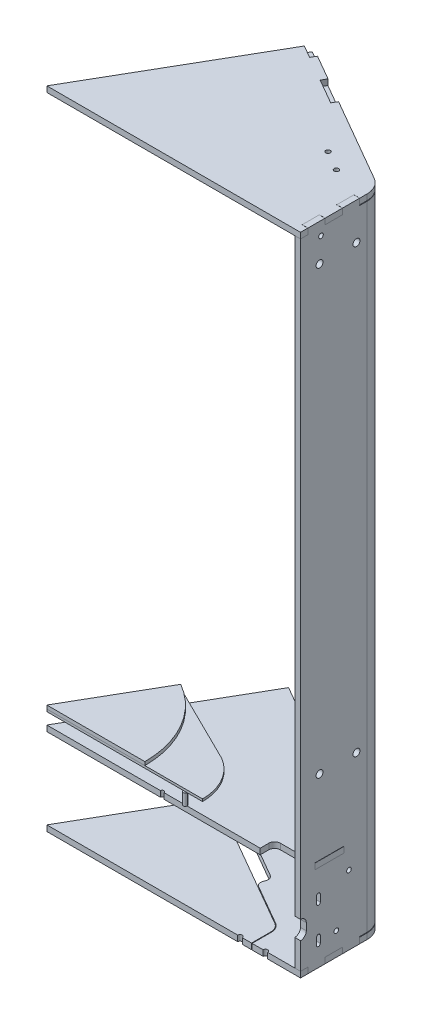
from build123d import *

# Parameters (mm, degrees)
SKETCH2_W             = 5
SKETCH2_H             = 350
BOSS_EXTRUDE1_START   = -95
BOSS_EXTRUDE1_DEPTH   = 5
FILLET1_R             = 17
CUT_EXTRUDE30_DEPTH   = 606.564404964
THICKEN1_START        = -90
THICKEN1_DEPTH        = 550
BOSS_EXTRUDE7_DEPTH   = 5
SKETCH5_W             = 5
SKETCH5_H             = 15
CUT_EXTRUDE1_DEPTH    = 619.092689812
BOSS_EXTRUDE2_REACH   = 620.093
SKETCH7_W             = 5
SKETCH7_H             = 14.8
SKETCH22_W            = 35.037696658
SKETCH22_H            = 0.5
CUT_EXTRUDE8_DEPTH    = 534.538726991
BOSS_EXTRUDE3_DEPTH   = 3
BOSS_EXTRUDE4_DEPTH   = 2
SKETCH10_R            = 130
SKETCH10_R_2          = 85
CUT_EXTRUDE2_DEPTH    = 534.538726991
SKETCH11_R            = 1.625
BOSS_EXTRUDE5_DEPTH   = 10
BOSS_EXTRUDE6_DEPTH   = 5
CUT_EXTRUDE21_DEPTH   = 547.661296599
SKETCH13_W            = 25
SKETCH13_H            = 5.2
CUT_EXTRUDE4_DEPTH    = 534.538726991
CUT_EXTRUDE5_DEPTH    = 10
SKETCH21_R            = 2
CUT_EXTRUDE7_DEPTH    = 532.496541098
SKETCH24_W            = 121.884572681
SKETCH24_H            = 40
BOSS_EXTRUDE8_DEPTH   = 5
BOSS_EXTRUDE8_2_DEPTH = 5
SKETCH27_R            = 2
SKETCH27_R_2          = 3
CUT_EXTRUDE10_DEPTH   = 5
SKETCH25_R            = 2
CUT_EXTRUDE9_DEPTH    = 615.579733281
SKETCH41_R            = 2
CUT_EXTRUDE22_DEPTH   = 620.098738942
CUT_EXTRUDE23_DEPTH   = 620.098738942
CUT_EXTRUDE6_DEPTH    = 10
FILLET2_R             = 5
SKETCH43_R            = 2
CUT_EXTRUDE24_DEPTH   = 620.098738942
SKETCH28_R            = 2
CUT_EXTRUDE11_DEPTH   = 620.098738942
SKETCH29_R            = 2
CUT_EXTRUDE12_DEPTH   = 506.811549291
SKETCH44_R            = 2
CUT_EXTRUDE25_DEPTH   = 506.811549291
LPATTERN1_COUNT       = 10
LPATTERN1_PITCH       = 25
SKETCH47_R            = 2
CUT_EXTRUDE28_DEPTH   = 507.378280988
SKETCH45_W            = 2.5
SKETCH45_H            = 8
CUT_EXTRUDE26_DEPTH   = 10
CUT_EXTRUDE31_DEPTH   = 506.811549291
SKETCH31_R            = 2
SKETCH31_R_2          = 1.5
CUT_EXTRUDE14_DEPTH   = 548.798547424
SKETCH30_W            = 121.884572681
SKETCH30_H            = 474.5
SKETCH30_R            = 2
BOSS_EXTRUDE9_DEPTH   = 5
SKETCH52_R            = 2
CUT_EXTRUDE32_DEPTH   = 506.811549291
SKETCH48_W            = 121.634572681
SKETCH48_H            = 433.75
BOSS_EXTRUDE13_DEPTH  = 5
SKETCH49_R            = 2
CUT_EXTRUDE29_DEPTH   = 507.378280988
SKETCH32_W            = 40
SKETCH32_H            = 28
BOSS_EXTRUDE10_DEPTH  = 28
CUT_EXTRUDE15_DEPTH   = 522.844237142
SKETCH34_W            = 14.5
SKETCH34_H            = 24
CUT_EXTRUDE16_DEPTH   = 24
SKETCH35_R            = 2
CUT_EXTRUDE17_DEPTH   = 506.811549291
BOSS_EXTRUDE11_DEPTH  = 3
CHAMFER1_SIZE         = 2.75
BOSS_EXTRUDE12_DEPTH  = 0.5
CUT_EXTRUDE18_DEPTH   = 1
CHAMFER2_SIZE         = 0.125
CUT_EXTRUDE20_DEPTH   = 522.844237142
CHAMFER3_SIZE         = 0.25


# Read off the part's stored shape, not the designer's step: Thicken1
with BuildPart() as part:
    # Sketch2 → Revolve1 (revolve)
    with BuildSketch(Plane(origin=(195, 0, 0), x_dir=(0, 0, -1), z_dir=(1, 0, 0))):
        with Locations((30, 275)):
            Rectangle(SKETCH2_W, SKETCH2_H)
    revolve(axis=Axis((195, 450, -32.5), (0, -1, 0)))


with BuildPart() as body_2:
    # Sketch3 → Boss-Extrude1 (new body)
    with BuildSketch(Plane(origin=(0, 0, 0), x_dir=(1, 0, 0), z_dir=(0, 1, 0)).offset(BOSS_EXTRUDE1_START)):
        Polygon((220, 67.5), (84.228357378, 145.887794416), (0, 0), (220, 0), (220, 32.5), align=None)
    extrude(amount=BOSS_EXTRUDE1_DEPTH)

    # Fillet1
    fillet1_edges = [body_2.edges().sort_by_distance(p)[0] for p in [
        (220, -92.5, -67.5),
    ]]
    fillet(fillet1_edges, radius=FILLET1_R)

    # Sketch50 → Cut-Extrude30 (cut, through all)
    with BuildSketch(Plane.XZ.offset(95)):
        Polygon((81.728357378, -141.557667397), (92.553674925, -135.307667397), (95.053674925, -139.637794416), (84.228357378, -145.887794416), align=None)
        Polygon((116.70431002, -127.137794416), (114.20431002, -122.807667397), (135.854945114, -110.307667397), (138.354945114, -114.637794416), align=None)
    extrude(amount=-CUT_EXTRUDE30_DEPTH, mode=Mode.SUBTRACT)


with BuildPart() as body_3:
    # Thicken1 outline → Thicken1 (new body)
    with BuildSketch(Plane(origin=(0, 0, 0), x_dir=(1, 0, 0), z_dir=(0, 1, 0)).offset(THICKEN1_START)):
        with BuildLine():
            Line((211.5, 72.407477288), (190, 84.820508076))
            Line((190, 84.820508076), (187.5, 80.490381057))
            Line((187.5, 80.490381057), (209, 68.077350269))
            ThreePointArc((209, 68.077350269), (213.392304845, 63.685045424), (215, 57.685045424))
            Line((215, 57.685045424), (215, 0))
            Line((215, 0), (220, 0))
            Line((220, 0), (220, 57.685045424))
            ThreePointArc((220, 57.685045424), (217.722431864, 66.185045424), (211.5, 72.407477288))
        make_face()
    extrude(amount=THICKEN1_DEPTH)



with BuildPart() as body_4:
    # Sketch23 → Boss-Extrude7 (new body)
    with BuildSketch(Plane(origin=(0, 460, 0), x_dir=(1, 0, 0), z_dir=(0, 1, 0))):
        with BuildLine():
            Line((220, 0), (220, 57.685045424))
            ThreePointArc((220, 57.685045424), (217.722431864, 66.185045424), (211.5, 72.407477288))
            Line((211.5, 72.407477288), (138.354945114, 114.637794416))
            Line((138.354945114, 114.637794416), (135.854945114, 110.307667397))
            Line((135.854945114, 110.307667397), (114.20431002, 122.807667397))
            Line((114.20431002, 122.807667397), (116.70431002, 127.137794416))
            Line((116.70431002, 127.137794416), (95.053674925, 139.637794416))
            Line((95.053674925, 139.637794416), (92.553674925, 135.307667397))
            Line((92.553674925, 135.307667397), (81.728357378, 141.557667397))
            Line((81.728357378, 141.557667397), (0, 0))
            Line((0, 0), (220, 0))
        make_face()
    extrude(amount=BOSS_EXTRUDE7_DEPTH)


with BuildPart() as cut_extrude1_tool:
    # Sketch5 → Cut-Extrude1 (new, through all)
    with BuildSketch(Plane.XZ.offset(95)):
        with Locations((217.5, -43.842522712)):
            Rectangle(SKETCH5_W, SKETCH5_H)
        with Locations((217.5, -13.842522712)):
            Rectangle(SKETCH5_W, SKETCH5_H)
    extrude(amount=-CUT_EXTRUDE1_DEPTH)


with BuildPart() as body_2_1:
    add(body_2.part)

    # Cut-Extrude1: cut by cut_extrude1_tool
    add(cut_extrude1_tool.part, mode=Mode.SUBTRACT)

    # Sketch25 → Cut-Extrude9 (cut, through all)
    with BuildSketch(Plane(origin=(0, -90, 0), x_dir=(1, 0, 0), z_dir=(0, 1, 0))):
        with Locations(Location((200, 31, 0), (0, 0, 270))):
            Circle(SKETCH25_R)
        with Locations((189.5, 0)):
            Circle(SKETCH25_R)
        with Locations(Location((188.660254038, 62.5, 0), (0, 0, 270))):
            Circle(SKETCH25_R)
        with Locations(Location((171.339745962, 72.5, 0), (0, 0, 270))):
            Circle(SKETCH25_R)
    extrude(amount=-CUT_EXTRUDE9_DEPTH, mode=Mode.SUBTRACT)

    # Sketch41 → Cut-Extrude22 (cut, through all)
    with BuildSketch(Plane.XZ.offset(95)):
        with Locations((167.5, 0)):
            Circle(SKETCH41_R)
    extrude(amount=-CUT_EXTRUDE22_DEPTH, mode=Mode.SUBTRACT)

    # Sketch42 → Cut-Extrude23 (cut, through all)
    with BuildSketch(Plane.XZ.offset(95)):
        with BuildLine():
            Line((108.354945114, -62.676270189), (54.228357378, -93.926270189))
            Line((54.228357378, -93.926270189), (53.978357378, -93.493257487))
            Line((53.978357378, -93.493257487), (108.104945114, -62.243257487))
            Line((108.104945114, -62.243257487), (172.75, -24.920417647))
            ThreePointArc((172.75, -24.920417647), (176.227241336, -21.443176311), (177.5, -16.693176311))
            Line((177.5, -16.693176311), (177.5, 0))
            Line((177.5, 0), (178, 0))
            Line((178, 0), (178, -16.693176311))
            ThreePointArc((178, -16.693176311), (176.660254038, -21.693176311), (173, -25.353430349))
            Line((173, -25.353430349), (108.354945114, -62.676270189))
        make_face()
    extrude(amount=-CUT_EXTRUDE23_DEPTH, mode=Mode.SUBTRACT)


with BuildPart() as body_4_1:
    add(body_4.part)

    # Cut-Extrude1: cut by cut_extrude1_tool
    add(cut_extrude1_tool.part, mode=Mode.SUBTRACT)


with BuildPart() as body_3_1:
    add(body_3.part)

    # Boss-Extrude2: up to this face of the body (flat: up to its plane)
    boss_extrude2_end = Plane(body_4_1.part.faces().sort_by_distance((116.920273172, 465, -53.131070851))[0])
    # Sketch7 → Boss-Extrude2 (add, up to the picked face)
    with BuildSketch(Plane.XZ.offset(95), mode=Mode.PRIVATE) as boss_extrude2_sk1:
        with Locations((217.5, -13.842522712)):
            Rectangle(SKETCH7_W, SKETCH7_H)
    boss_extrude2_tool1 = split(extrude(boss_extrude2_sk1.sketch, amount=-BOSS_EXTRUDE2_REACH, mode=Mode.PRIVATE), bisect_by=boss_extrude2_end, keep=Keep.BOTH, mode=Mode.PRIVATE)
    # Sketch7 → Boss-Extrude2 (add, up to the picked face)
    with BuildSketch(Plane.XZ.offset(95), mode=Mode.PRIVATE) as boss_extrude2_sk2:
        with Locations((217.5, -43.842522712)):
            Rectangle(SKETCH7_W, SKETCH7_H)
    boss_extrude2_tool2 = split(extrude(boss_extrude2_sk2.sketch, amount=-BOSS_EXTRUDE2_REACH, mode=Mode.PRIVATE), bisect_by=boss_extrude2_end, keep=Keep.BOTH, mode=Mode.PRIVATE)
    add(boss_extrude2_tool1.solids().sort_by(Axis((217.5, -95, -13.842523), (0, 1, 0)))[0])
    add(boss_extrude2_tool2.solids().sort_by(Axis((217.5, -95, -43.842523), (0, 1, 0)))[0])

    # Sketch22 → Cut-Extrude8 (cut, through all)
    with BuildSketch(Plane(origin=(220, 0, 0), x_dir=(0, 0, -1), z_dir=(1, 0, 0))):
        with Locations((68.761371041, -89.75)):
            Rectangle(SKETCH22_W, SKETCH22_H)
        with Locations((68.761371041, 459.75)):
            Rectangle(SKETCH22_W, SKETCH22_H)
    extrude(amount=-CUT_EXTRUDE8_DEPTH, mode=Mode.SUBTRACT)

    # Sketch13 → Cut-Extrude4 (cut, through all)
    with BuildSketch(Plane(origin=(220, 0, 0), x_dir=(0, 0, -1), z_dir=(1, 0, 0))):
        with Locations((25, -17.4)):
            Rectangle(SKETCH13_W, SKETCH13_H)
    extrude(amount=-CUT_EXTRUDE4_DEPTH, mode=Mode.SUBTRACT)

    # Sketch14 → Cut-Extrude5 (cut)
    with BuildSketch(Plane(origin=(220, 0, 0), x_dir=(0, 0, -1), z_dir=(1, 0, 0))):
        with BuildLine():
            Line((13.875, -40.5), (13.875, -46.5))
            ThreePointArc((13.875, -46.5), (15.5, -48.125), (17.125, -46.5))
            Line((17.125, -46.5), (17.125, -40.5))
            ThreePointArc((17.125, -40.5), (15.5, -38.875), (13.875, -40.5))
        make_face()
        with BuildLine():
            Line((17.125, -71.5), (17.125, -77.5))
            ThreePointArc((17.125, -77.5), (15.5, -79.125), (13.875, -77.5))
            Line((13.875, -77.5), (13.875, -71.5))
            ThreePointArc((13.875, -71.5), (15.5, -69.875), (17.125, -71.5))
        make_face()
        with BuildLine():
            Line((5, -56), (5, -62))
            ThreePointArc((5, -62), (0, -67), (-5, -62))
            Line((-5, -62), (-5, -56))
            ThreePointArc((-5, -56), (0, -51), (5, -56))
        make_face()
    extrude(amount=-CUT_EXTRUDE5_DEPTH, mode=Mode.SUBTRACT)

    # Sketch21 → Cut-Extrude7 (cut, through all)
    with BuildSketch(Plane.ZY.offset(-215)):
        with Locations((-31, -75)):
            Circle(SKETCH21_R)
    extrude(amount=-CUT_EXTRUDE7_DEPTH, mode=Mode.SUBTRACT)

    # Sketch27 → Cut-Extrude10 (cut)
    with BuildSketch(Plane.ZY.offset(-215)):
        with Locations((-17.75, 453.5)):
            Circle(SKETCH27_R)
        with Locations((-42, -35)):
            Circle(SKETCH27_R)
        with Locations((-48.5, 433)):
            Circle(SKETCH27_R_2)
        with Locations((-16.5, 433)):
            Circle(SKETCH27_R_2)
        with Locations((-16.5, 50)):
            Circle(SKETCH27_R_2)
        with Locations((-48.5, 50)):
            Circle(SKETCH27_R_2)
    extrude(amount=-CUT_EXTRUDE10_DEPTH, mode=Mode.SUBTRACT)


with BuildPart() as body_5:
    # Sketch8 → Boss-Extrude3 (new body)
    with BuildSketch(Plane(origin=(0, 0, 0), x_dir=(1, 0, 0), z_dir=(0, 1, 0))):
        with BuildLine():
            Line((110, 34.641016151), (42.5, 73.612159322))
            Line((42.5, 73.612159322), (0, 0))
            Line((0, 0), (130, 0))
            ThreePointArc((130, 0), (124.641016151, 20), (110, 34.641016151))
        make_face()
    extrude(amount=-BOSS_EXTRUDE3_DEPTH)

    # Sketch10 → Cut-Extrude2 (cut, through all)
    with BuildSketch(Plane(origin=(0, 0, 0), x_dir=(1, 0, 0), z_dir=(0, 1, 0))):
        Circle(SKETCH10_R)
        Circle(SKETCH10_R_2, mode=Mode.SUBTRACT)
    extrude(amount=-CUT_EXTRUDE2_DEPTH, mode=Mode.SUBTRACT)


with BuildPart() as body_6:
    # Sketch9 → Boss-Extrude4 (new body)
    with BuildSketch(Plane.XZ.offset(3)):
        with BuildLine():
            Line((135, 0), (0, 0))
            Line((0, 0), (42.5, -73.612159322))
            Line((42.5, -73.612159322), (112.5, -38.97114317))
            ThreePointArc((112.5, -38.97114317), (128.97114317, -22.5), (135, 0))
        make_face()
    extrude(amount=BOSS_EXTRUDE4_DEPTH)


with BuildPart() as body_7:
    # Sketch11 → Boss-Extrude5 (new body)
    with BuildSketch(Plane.XZ.offset(5)):
        with Locations(Location((120, 0, 0), (0, 0, 270))):
            Circle(SKETCH11_R)
    extrude(amount=BOSS_EXTRUDE5_DEPTH)


with BuildPart() as body_8:
    # Sketch12 → Boss-Extrude6 (new body)
    with BuildSketch(Plane.XZ.offset(15)):
        Polygon((215, -53.06624327), (76.728357378, -132.89741336), (0, 0), (215, 0), (215, -12.5), (220, -12.5), (220, -37.5), (215, -37.5), align=None)
    extrude(amount=BOSS_EXTRUDE6_DEPTH)

    # Sketch40 → Cut-Extrude21 (cut, through all)
    with BuildSketch(Plane(origin=(0, -15, 0), x_dir=(1, 0, 0), z_dir=(0, 1, 0))):
        with BuildLine():
            Line((215, 12.5), (190, 12.5))
            ThreePointArc((190, 12.5), (186.464466094, 11.035533906), (185, 7.5))
            Line((185, 7.5), (185, 0))
            Line((185, 0), (215, 0))
            Line((215, 0), (215, 12.5))
        make_face()
    extrude(amount=-CUT_EXTRUDE21_DEPTH, mode=Mode.SUBTRACT)

    # Sketch31 → Cut-Extrude14 (cut, through all)
    with BuildSketch(Plane(origin=(0, -15, 0), x_dir=(1, 0, 0), z_dir=(0, 1, 0))):
        with Locations(Location((200, 42, 0), (0, 0, 270))):
            Circle(SKETCH31_R)
        with Locations(Location((149.689110868, 85, 0), (0, 0, 270))):
            Circle(SKETCH31_R)
        with Locations(Location((188.660254038, 62.5, 0), (0, 0, 270))):
            Circle(SKETCH31_R)
        with Locations(Location((171.339745962, 72.5, 0), (0, 0, 270))):
            Circle(SKETCH31_R)
        with Locations((100, 0)):
            Circle(SKETCH31_R_2)
    extrude(amount=-CUT_EXTRUDE14_DEPTH, mode=Mode.SUBTRACT)


with BuildPart() as body_9:
    # Sketch24 → Boss-Extrude8 (new body)
    with BuildSketch(Plane(origin=(84.228357378, 0, -145.887794416), x_dir=(-0.8660254037844382, 0, -0.5000000000000007), z_dir=(0.5000000000000008, 0, -0.8660254037844383))):
        with Locations((-60.942286341, 439.75)):
            Rectangle(SKETCH24_W, SKETCH24_H)
    extrude(amount=-BOSS_EXTRUDE8_DEPTH)


with BuildPart() as body_10:
    # Sketch24 → Boss-Extrude8 2 (new body)
    with BuildSketch(Plane(origin=(84.228357378, 0, -145.887794416), x_dir=(-0.8660254037844382, 0, -0.5000000000000007), z_dir=(0.5000000000000008, 0, -0.8660254037844383))):
        Polygon((-121.884572681, -89.75), (-62.4, -89.75), (-62.4, -95), (-37.6, -95), (-37.6, -89.75), (-12.4, -89.75), (-12.4, -95), (0, -95), (0, -89.75), (0, -15), (-121.884572681, -15), align=None)
    extrude(amount=-BOSS_EXTRUDE8_2_DEPTH)


with BuildPart() as cut_extrude23_piece_1:
    # of the separate pieces the step leaves, piece 1, a body of its own (cut_extrude23_pieces)
    add(body_2_1.part.solids().sort_by_distance((211.5, -95, -72.407477288))[0])

    # Sketch20 → Cut-Extrude6 (cut)
    with BuildSketch(Plane(origin=(0, -90, 0), x_dir=(1, 0, 0), z_dir=(0, 1, 0))):
        Polygon((67.888611416, 97.586524227), (139.019237886, 56.519237886), (134.019237886, 47.858983849), (62.888611416, 88.926270189), align=None)
    extrude(amount=-CUT_EXTRUDE6_DEPTH, mode=Mode.SUBTRACT)

    # Fillet2
    fillet2_edges = [cut_extrude23_piece_1.edges().sort_by_distance(p)[0] for p in [
        (67.888611416, -92.5, -97.586524227),
        (139.019237886, -92.5, -56.519237886),
    ]]
    fillet(fillet2_edges, radius=FILLET2_R)
    fillet2_2_edges = [cut_extrude23_piece_1.edges().sort_by_distance(p)[0] for p in [
        (62.888611416, -92.5, -88.926270189),
        (134.019237886, -92.5, -47.858983849),
    ]]
    fillet(fillet2_2_edges, radius=FILLET2_R - 0.0001)  # a hair under: the kernel refuses the full size


with BuildPart() as cut_extrude23_piece_2:
    # of the separate pieces the step leaves, piece 2, a body of its own (cut_extrude23_pieces)
    add(body_2_1.part.solids().sort_by_distance((53.978357378, -95, -93.493257487))[0])


with BuildPart() as cut_extrude24_tool:
    # Sketch43 → Cut-Extrude24 (new, through all)
    with BuildSketch(Plane.XZ.offset(95)):
        with Locations((59.103357378, -102.370017876)):
            Circle(SKETCH43_R)
        with Locations((49.103357378, -85.0495098)):
            Circle(SKETCH43_R)
    extrude(amount=-CUT_EXTRUDE24_DEPTH)


with BuildPart() as cut_extrude23_piece_1_1:
    add(cut_extrude23_piece_1.part)

    # Cut-Extrude24: cut by cut_extrude24_tool
    add(cut_extrude24_tool.part, mode=Mode.SUBTRACT)


with BuildPart() as cut_extrude23_piece_2_1:
    add(cut_extrude23_piece_2.part)

    # Cut-Extrude24: cut by cut_extrude24_tool
    add(cut_extrude24_tool.part, mode=Mode.SUBTRACT)


with BuildPart() as body_4_2:
    add(body_4_1.part)

    # Sketch28 → Cut-Extrude11 (cut, through all)
    with BuildSketch(Plane(origin=(0, 465, 0), x_dir=(1, 0, 0), z_dir=(0, 1, 0))):
        with Locations(Location((171.339745962, 72.5, 0), (0, 0, 270))):
            Circle(SKETCH28_R)
        with Locations(Location((188.660254038, 62.5, 0), (0, 0, 270))):
            Circle(SKETCH28_R)
    extrude(amount=-CUT_EXTRUDE11_DEPTH, mode=Mode.SUBTRACT)


with BuildPart() as cut_extrude12_tool:
    # Sketch29 → Cut-Extrude12 (new, through all)
    with BuildSketch(Plane(origin=(81.728357378, 0, -141.557667397), x_dir=(0.8660254037844384, 0, 0.5000000000000007), z_dir=(-0.5000000000000007, 0, 0.8660254037844384))):
        with Locations((112.134572681, -75)):
            Circle(SKETCH29_R)
        with Locations((87.134572681, -35)):
            Circle(SKETCH29_R)
        with Locations((112.134572681, 445)):
            Circle(SKETCH29_R)
        with BuildLine():
            Line((129.134572681, 447), (135.134572681, 447))
            ThreePointArc((135.134572681, 447), (137.134572681, 445), (135.134572681, 443))
            Line((135.134572681, 443), (129.134572681, 443))
            ThreePointArc((129.134572681, 443), (127.134572681, 445), (129.134572681, 447))
        make_face()
        with BuildLine():
            Line((129.134572681, -73), (135.134572681, -73))
            ThreePointArc((135.134572681, -73), (137.134572681, -75), (135.134572681, -77))
            Line((135.134572681, -77), (129.134572681, -77))
            ThreePointArc((129.134572681, -77), (127.134572681, -75), (129.134572681, -73))
        make_face()
    extrude(amount=-CUT_EXTRUDE12_DEPTH)


with BuildPart() as body_3_2:
    add(body_3_1.part)

    # Cut-Extrude12: cut by cut_extrude12_tool
    add(cut_extrude12_tool.part, mode=Mode.SUBTRACT)

    # Sketch44 → Cut-Extrude25 (cut, through all)
    with BuildSketch(Plane(origin=(81.728357378, 0, -141.557667397), x_dir=(0.8660254037844382, 0, 0.5000000000000007), z_dir=(-0.5000000000000008, 0, 0.8660254037844383))):
        with Locations((134.384572681, 189.875)):
            Circle(SKETCH44_R)
    cut_extrude25 = extrude(amount=-CUT_EXTRUDE25_DEPTH, mode=Mode.SUBTRACT)

    # LPattern1: Cut-Extrude25 ×10, 3 skipped
    with Locations(*[(0, -i * LPATTERN1_PITCH, 0) for i in range(1, LPATTERN1_COUNT) if i not in (3, 8, 9)]):
        add(cut_extrude25, mode=Mode.SUBTRACT)

    # Sketch47 → Cut-Extrude28 (cut, through all)
    with BuildSketch(Plane(origin=(84.228357378, 0, -145.887794416), x_dir=(-0.8660254037844382, 0, -0.5000000000000007), z_dir=(0.5000000000000008, 0, -0.8660254037844383))):
        with Locations(Location((-134.384572681, 189.875, 0), (0, 0, 180))):
            Circle(SKETCH47_R)
        with Locations(Location((-134.384572681, 164.875, 0), (0, 0, 180))):
            Circle(SKETCH47_R)
        with Locations(Location((-134.384572681, 139.875, 0), (0, 0, 180))):
            Circle(SKETCH47_R)
        with Locations(Location((-134.384572681, 89.875, 0), (0, 0, 180))):
            Circle(SKETCH47_R)
        with Locations(Location((-134.384572681, 64.875, 0), (0, 0, 180))):
            Circle(SKETCH47_R)
        with Locations(Location((-134.384572681, 39.875, 0), (0, 0, 180))):
            Circle(SKETCH47_R)
        with Locations(Location((-134.384572681, 14.875, 0), (0, 0, 180))):
            Circle(SKETCH47_R)
        with Locations(Location((-134.384572681, 389.875, 0), (0, 0, 180))):
            Circle(SKETCH47_R)
        with Locations(Location((-134.384572681, 364.875, 0), (0, 0, 180))):
            Circle(SKETCH47_R)
        with Locations(Location((-134.384572681, 339.875, 0), (0, 0, 180))):
            Circle(SKETCH47_R)
        with Locations(Location((-134.384572681, 314.875, 0), (0, 0, 180))):
            Circle(SKETCH47_R)
        with Locations(Location((-134.384572681, 264.875, 0), (0, 0, 180))):
            Circle(SKETCH47_R)
        with Locations(Location((-134.384572681, 239.875, 0), (0, 0, 180))):
            Circle(SKETCH47_R)
        with Locations(Location((-134.384572681, 214.875, 0), (0, 0, 180))):
            Circle(SKETCH47_R)
    extrude(amount=-CUT_EXTRUDE28_DEPTH, mode=Mode.SUBTRACT)

    # Sketch45 → Cut-Extrude26 (cut)
    with BuildSketch(Plane(origin=(84.228357378, 0, -145.887794416), x_dir=(-0.8660254037844382, 0, -0.5000000000000007), z_dir=(0.5000000000000008, 0, -0.8660254037844383))):
        with Locations((-130.634572681, 114.875)):
            Rectangle(SKETCH45_W, SKETCH45_H)
        with Locations((-130.634572681, 414.875)):
            Rectangle(SKETCH45_W, SKETCH45_H)
        with Locations((-138.134572681, 414.875)):
            Rectangle(SKETCH45_W, SKETCH45_H)
        with Locations((-130.634572681, 289.875)):
            Rectangle(SKETCH45_W, SKETCH45_H)
        with Locations((-138.134572681, 289.875)):
            Rectangle(SKETCH45_W, SKETCH45_H)
        with Locations((-138.134572681, 114.875)):
            Rectangle(SKETCH45_W, SKETCH45_H)
        with Locations((-130.634572681, -35.125)):
            Rectangle(SKETCH45_W, SKETCH45_H)
        with Locations((-138.134572681, -35.125)):
            Rectangle(SKETCH45_W, SKETCH45_H)
    extrude(amount=-CUT_EXTRUDE26_DEPTH, mode=Mode.SUBTRACT)

    # Sketch51 → Cut-Extrude31 (cut, through all)
    with BuildSketch(Plane(origin=(81.728357378, 0, -141.557667397), x_dir=(0.8660254037844382, 0, 0.5000000000000007), z_dir=(-0.5000000000000008, 0, 0.8660254037844383))):
        with BuildLine():
            Line((129.134572681, 2), (135.134572681, 2))
            ThreePointArc((135.134572681, 2), (137.134572681, 0), (135.134572681, -2))
            Line((135.134572681, -2), (129.134572681, -2))
            ThreePointArc((129.134572681, -2), (127.134572681, 0), (129.134572681, 2))
        make_face()
    extrude(amount=-CUT_EXTRUDE31_DEPTH, mode=Mode.SUBTRACT)


with BuildPart() as body_9_1:
    add(body_9.part)

    # Cut-Extrude12: cut by cut_extrude12_tool
    add(cut_extrude12_tool.part, mode=Mode.SUBTRACT)


with BuildPart() as body_10_1:
    add(body_10.part)

    # Cut-Extrude12: cut by cut_extrude12_tool
    add(cut_extrude12_tool.part, mode=Mode.SUBTRACT)


with BuildPart() as body_12:
    # Sketch30 → Boss-Extrude9 (new body)
    with BuildSketch(Plane(origin=(84.228357378, 0, -145.887794416), x_dir=(-0.8660254037844384, 0, -0.5000000000000007), z_dir=(0.5000000000000007, 0, -0.8660254037844384))):
        with Locations((-60.942286341, 222.5)):
            Rectangle(SKETCH30_W, SKETCH30_H)
        with Locations((-112.134572681, 445)):
            Circle(SKETCH30_R, mode=Mode.SUBTRACT)
        with Locations((-112.134572681, 0)):
            Circle(SKETCH30_R, mode=Mode.SUBTRACT)
    extrude(amount=-BOSS_EXTRUDE9_DEPTH)

    # Sketch52 → Cut-Extrude32 (cut, through all)
    with BuildSketch(Plane(origin=(81.728357378, 0, -141.557667397), x_dir=(0.8660254037844384, 0, 0.5000000000000007), z_dir=(-0.5000000000000007, 0, 0.8660254037844384))):
        with Locations((109.384572681, 214.875)):
            Circle(SKETCH52_R)
        with Locations((109.384572681, 189.875)):
            Circle(SKETCH52_R)
    extrude(amount=-CUT_EXTRUDE32_DEPTH, mode=Mode.SUBTRACT)


with BuildPart() as body_13:
    # Sketch48 → Boss-Extrude13 (new body)
    with BuildSketch(Plane(origin=(84.228357378, 0, -145.887794416), x_dir=(-0.8660254037844382, 0, -0.5000000000000009), z_dir=(0.5000000000000009, 0, -0.8660254037844382))):
        with Locations((-60.817286341, 202.375)):
            Rectangle(SKETCH48_W, SKETCH48_H)
    extrude(amount=-BOSS_EXTRUDE13_DEPTH)

    # Sketch49 → Cut-Extrude29 (cut, through all)
    with BuildSketch(Plane(origin=(84.228357378, 0, -145.887794416), x_dir=(-0.866025403784438, 0, -0.5000000000000012), z_dir=(0.5000000000000011, 0, -0.8660254037844379))):
        with Locations((-109.384572681, 389.875)):
            Circle(SKETCH49_R)
        with Locations((-109.384572681, 364.875)):
            Circle(SKETCH49_R)
        with Locations((-109.384572681, 39.875)):
            Circle(SKETCH49_R)
        with Locations((-109.384572681, 14.875)):
            Circle(SKETCH49_R)
    extrude(amount=-CUT_EXTRUDE29_DEPTH, mode=Mode.SUBTRACT)


with BuildPart() as body_14:
    # Sketch32 → Boss-Extrude10 (new body)
    with BuildSketch(Plane(origin=(81.728357378, 0, -141.557667397), x_dir=(0.8660254037844382, 0, 0.5000000000000007), z_dir=(-0.5000000000000008, 0, 0.8660254037844383))):
        with Locations((122.134572681, -76)):
            Rectangle(SKETCH32_W, SKETCH32_H)
    extrude(amount=BOSS_EXTRUDE10_DEPTH)

    # Sketch33 → Cut-Extrude15 (cut, through all)
    with BuildSketch(Plane(origin=(88.451134547, 0, 51.067286341), x_dir=(-0.5000000000000009, 0, 0.8660254037844383), z_dir=(-0.8660254037844382, 0, -0.5000000000000008))):
        Polygon((-157.056714755, -62), (-157.056714755, -67.5), (-140.956714755, -83.6), (-135.456714755, -83.6), (-135.456714755, -62), align=None)
    extrude(amount=-CUT_EXTRUDE15_DEPTH, mode=Mode.SUBTRACT)

    # Sketch34 → Cut-Extrude16 (cut)
    with BuildSketch(Plane(origin=(67.728357378, 0, -117.308956091), x_dir=(0.866025403784438, 0, 0.5000000000000011), z_dir=(-0.5000000000000011, 0, 0.8660254037844382))):
        with Locations((112.384572681, -74)):
            Rectangle(SKETCH34_W, SKETCH34_H)
        with Locations((131.884572681, -74)):
            Rectangle(SKETCH34_W, SKETCH34_H)
    extrude(amount=-CUT_EXTRUDE16_DEPTH, mode=Mode.SUBTRACT)

    # Sketch35 → Cut-Extrude17 (cut, through all)
    with BuildSketch(Plane(origin=(81.728357378, 0, -141.557667397), x_dir=(-0.8660254037844379, 0, -0.5000000000000014), z_dir=(0.5000000000000013, 0, -0.8660254037844378))):
        with Locations(Location((-112.134572681, -75, 0), (0, 0, 180))):
            Circle(SKETCH35_R)
        with Locations((-132.134572681, -75)):
            Circle(SKETCH35_R)
    extrude(amount=-CUT_EXTRUDE17_DEPTH, mode=Mode.SUBTRACT)

    # Sketch36 → Boss-Extrude11 (add)
    # profile 1 of 2: a face of its own
    with BuildSketch(Plane(origin=(79.728357378, 0, -138.093565782), x_dir=(0.866025403784438, 0, 0.5000000000000011), z_dir=(-0.5000000000000011, 0, 0.8660254037844382))):
        Polygon((138.759572681, -71.175054467), (132.134572681, -67.350108933), (125.509572681, -71.175054467), (125.509572681, -78.824945533), (132.134572681, -82.649891067), (138.759572681, -78.824945533), align=None)
        Polygon((132.134572681, -79.185789452), (135.759572681, -77.092894726), (135.759572681, -72.907105274), (132.134572681, -70.814210548), (128.509572681, -72.907105274), (128.509572681, -77.092894726), align=None, mode=Mode.SUBTRACT)
    # profile 2 of 2: a face of its own
    with BuildSketch(Plane(origin=(79.728357378, 0, -138.093565782), x_dir=(0.866025403784438, 0, 0.5000000000000011), z_dir=(-0.5000000000000011, 0, 0.8660254037844382))):
        Polygon((118.759572681, -71.175054467), (112.134572681, -67.350108933), (105.509572681, -71.175054467), (105.509572681, -78.824945533), (112.134572681, -82.649891067), (118.759572681, -78.824945533), align=None)
        Polygon((112.134572681, -79.185789452), (115.759572681, -77.092894726), (115.759572681, -72.907105274), (112.134572681, -70.814210548), (108.509572681, -72.907105274), (108.509572681, -77.092894726), align=None, mode=Mode.SUBTRACT)
    extrude(amount=BOSS_EXTRUDE11_DEPTH)

    # Chamfer1
    chamfer1_edges = [body_14.edges().sort_by_distance(p)[0] for p in [
        (189.791544888, -69.2625817, -71.08445323),
        (186.922835738, -75, -72.74070323),
        (189.791544888, -80.7374183, -71.08445323),
        (195.528963188, -80.7374183, -67.77195323),
        (181.077164262, -75, -76.11570323),
        (178.208455112, -69.2625817, -77.77195323),
        (172.471036812, -69.2625817, -81.08445323),
        (169.602327662, -75, -82.74070323),
        (172.471036812, -80.7374183, -81.08445323),
        (178.208455112, -80.7374183, -77.77195323),
        (198.397672338, -75, -66.11570323),
        (195.528963188, -69.2625817, -67.77195323),
    ]]
    chamfer(chamfer1_edges, length=CHAMFER1_SIZE)

    # Sketch38 → Boss-Extrude12 (add)
    # profile 1 of 2: a face of its own
    with BuildSketch(Plane(origin=(78.228357378, 0, -135.495489571), x_dir=(0.8660254037844383, 0, 0.5000000000000008), z_dir=(-0.5000000000000007, 0, 0.8660254037844382))):
        Polygon((115.759572681, -72.907105274), (112.134572681, -70.814210548), (108.509572681, -72.907105274), (108.509572681, -77.092894726), (112.134572681, -79.185789452), (115.759572681, -77.092894726), align=None)
        Polygon((115.509572681, -73.051442841), (112.134572681, -71.102885683), (108.759572681, -73.051442841), (108.759572681, -76.948557159), (112.134572681, -78.897114317), (115.509572681, -76.948557159), align=None, mode=Mode.SUBTRACT)
    # profile 2 of 2: a face of its own
    with BuildSketch(Plane(origin=(78.228357378, 0, -135.495489571), x_dir=(0.8660254037844383, 0, 0.5000000000000008), z_dir=(-0.5000000000000007, 0, 0.8660254037844382))):
        Polygon((132.134572681, -79.185789452), (135.759572681, -77.092894726), (135.759572681, -72.907105274), (132.134572681, -70.814210548), (128.509572681, -72.907105274), (128.509572681, -77.092894726), align=None)
        Polygon((132.134572681, -71.102885683), (128.759572681, -73.051442841), (128.759572681, -76.948557159), (132.134572681, -78.897114317), (135.509572681, -76.948557159), (135.509572681, -73.051442841), align=None, mode=Mode.SUBTRACT)
    extrude(amount=-BOSS_EXTRUDE12_DEPTH)

    # Sketch37 → Cut-Extrude18 (cut)
    with BuildSketch(Plane(origin=(79.728357378, 0, -138.093565782), x_dir=(0.866025403784438, 0, 0.5000000000000011), z_dir=(-0.5000000000000011, 0, 0.8660254037844382))):
        Polygon((108.509572681, -77.092894726), (112.134572681, -79.185789452), (115.759572681, -77.092894726), (115.759572681, -72.907105274), (112.134572681, -70.814210548), (108.509572681, -72.907105274), align=None)
        Polygon((128.509572681, -77.092894726), (132.134572681, -79.185789452), (135.759572681, -77.092894726), (135.759572681, -72.907105274), (132.134572681, -70.814210548), (128.509572681, -72.907105274), align=None)
    extrude(amount=-CUT_EXTRUDE18_DEPTH, mode=Mode.SUBTRACT)

    # Chamfer2
    chamfer2_edges = [body_14.edges().sort_by_distance(p)[0] for p in [
        (178.2625817, -75, -77.74070323),
        (176.801163831, -77.922835738, -78.58445323),
        (173.878328093, -77.922835738, -80.27195323),
        (172.416910224, -75, -81.11570323),
        (173.878328093, -72.077164262, -80.27195323),
        (176.801163831, -72.077164262, -78.58445323),
        (194.121671907, -72.077164262, -68.58445323),
        (195.583089776, -75, -67.74070323),
        (194.121671907, -77.922835738, -68.58445323),
        (191.198836169, -77.922835738, -70.27195323),
        (189.7374183, -75, -71.11570323),
        (191.198836169, -72.077164262, -70.27195323),
    ]]
    chamfer(chamfer2_edges, length=CHAMFER2_SIZE)

    # Sketch39 → Cut-Extrude20 (cut, through all)
    with BuildSketch(Plane(origin=(88.451134547, 0, 51.067286341), x_dir=(-0.5000000000000009, 0, 0.8660254037844383), z_dir=(-0.8660254037844382, 0, -0.5000000000000008))):
        Polygon((-163.456714755, -90), (-135.456714755, -62), (-135.456714755, -90), align=None)
    extrude(amount=-CUT_EXTRUDE20_DEPTH, mode=Mode.SUBTRACT)

    # Mirror1: body 14 across plane


with BuildPart() as body_14_1:
    add(body_14.part)
    add(body_14.part.mirror(Plane(origin=(247.432003018, -90, -45.888622981), x_dir=(0.2738612787525833, 0.5477225575051657, 0.7905694150420951), z_dir=(0.35355339059327434, 0.7071067811865475, -0.6123724356957942))))

    # Chamfer3
    chamfer3_edges = [body_14_1.edges().sort_by_distance(p)[0] for p in [
        (178.729088051, -75, -78.048715932),
        (177.159417007, -78.139342089, -78.954965932),
        (174.020074918, -78.139342089, -80.767465932),
        (172.450403873, -75, -81.673715932),
        (174.020074918, -71.860657911, -80.767465932),
        (177.159417007, -71.860657911, -78.954965932),
        (196.049596127, -75, -68.048715932),
        (194.479925082, -78.139342089, -68.954965932),
        (191.340582993, -78.139342089, -70.767465932),
        (189.770911949, -75, -71.673715932),
        (191.340582993, -71.860657911, -70.767465932),
        (194.479925082, -71.860657911, -68.954965932),
        (174.479088051, -83.5, -70.6875),
        (171.339745962, -83.5, -68.875),
        (168.200403873, -83.5, -70.6875),
        (168.200403873, -83.5, -74.3125),
        (171.339745962, -83.5, -76.125),
        (174.479088051, -83.5, -74.3125),
        (191.799596127, -83.5, -60.6875),
        (188.660254038, -83.5, -58.875),
        (185.520911949, -83.5, -60.6875),
        (185.520911949, -83.5, -64.3125),
        (188.660254038, -83.5, -66.125),
        (191.799596127, -83.5, -64.3125),
    ]]
    chamfer(chamfer3_edges, length=CHAMFER3_SIZE - 0.0001)  # a hair under: the kernel refuses the full size


solid = Compound([part.part, body_5.part, body_6.part, body_7.part, body_8.part, cut_extrude23_piece_1_1.part, cut_extrude23_piece_2_1.part, body_4_2.part, body_3_2.part, body_9_1.part, body_10_1.part, body_12.part, body_13.part, body_14_1.part])
